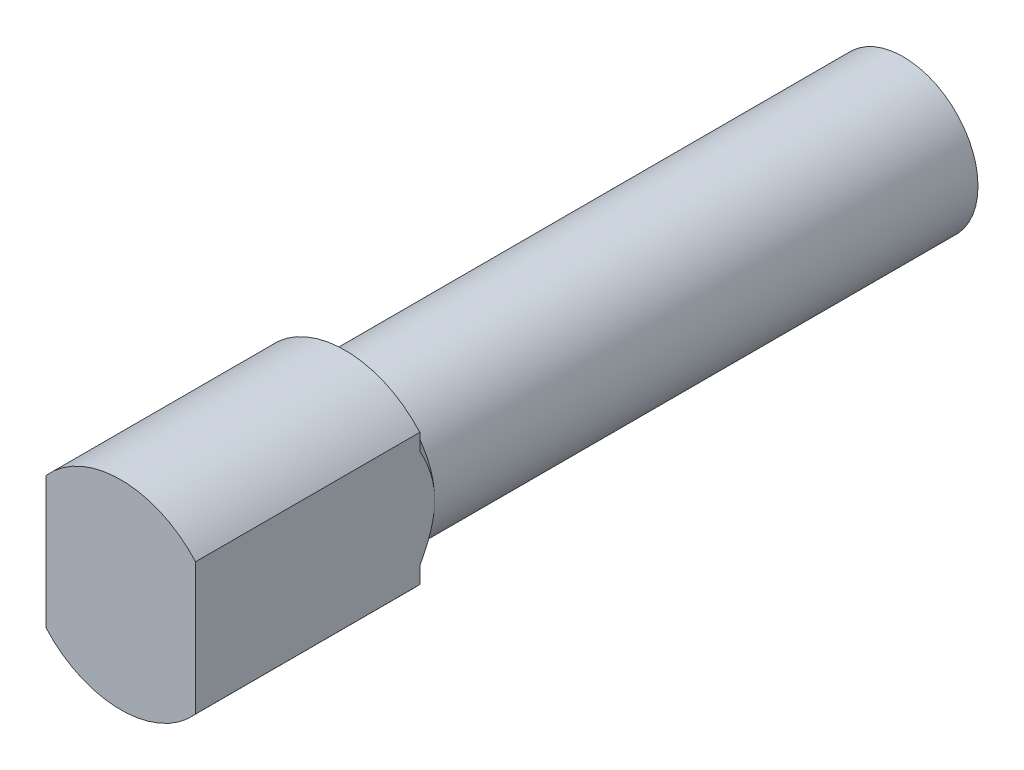
from build123d import *

# Parameters (mm, degrees)
SKETCH_1_R          = 15
EXTRUDE_1_DEPTH     = 112
SKETCH_2_R          = 20
EXTRUDE_2_DEPTH     = 45
CHAMFER_1_SIZE      = 3
SKETCH_3_W          = 15.452934815
SKETCH_3_H          = 42.066322552
CUT_EXTRUDE_3_DEPTH = 160.527427109


with BuildPart() as part:
    # Эскиз1 → Вытянуть1 (new body)
    with BuildSketch(Plane.XY):
        Circle(SKETCH_1_R)
    extrude(amount=EXTRUDE_1_DEPTH)

    # Эскиз2 → Вытянуть2 (add)
    with BuildSketch(Plane.XY.offset(112)):
        Circle(SKETCH_2_R)
    extrude(amount=EXTRUDE_2_DEPTH)

    # Фаска1
    chamfer_1_edges = [part.edges().sort_by_distance(p)[0] for p in [
        (-15, 0, 112),
    ]]
    chamfer(chamfer_1_edges, length=CHAMFER_1_SIZE)

    # Эскиз3 → Вытянуть3 (cut, through all)
    with BuildSketch(Plane.XY.offset(157)):
        with Locations((22.726467408, -0.268280118)):
            Rectangle(SKETCH_3_W, SKETCH_3_H)
        with Locations((-22.726467408, -0.268280118)):
            Rectangle(SKETCH_3_W, SKETCH_3_H)
    extrude(amount=-CUT_EXTRUDE_3_DEPTH, mode=Mode.SUBTRACT)


solid = part.part
